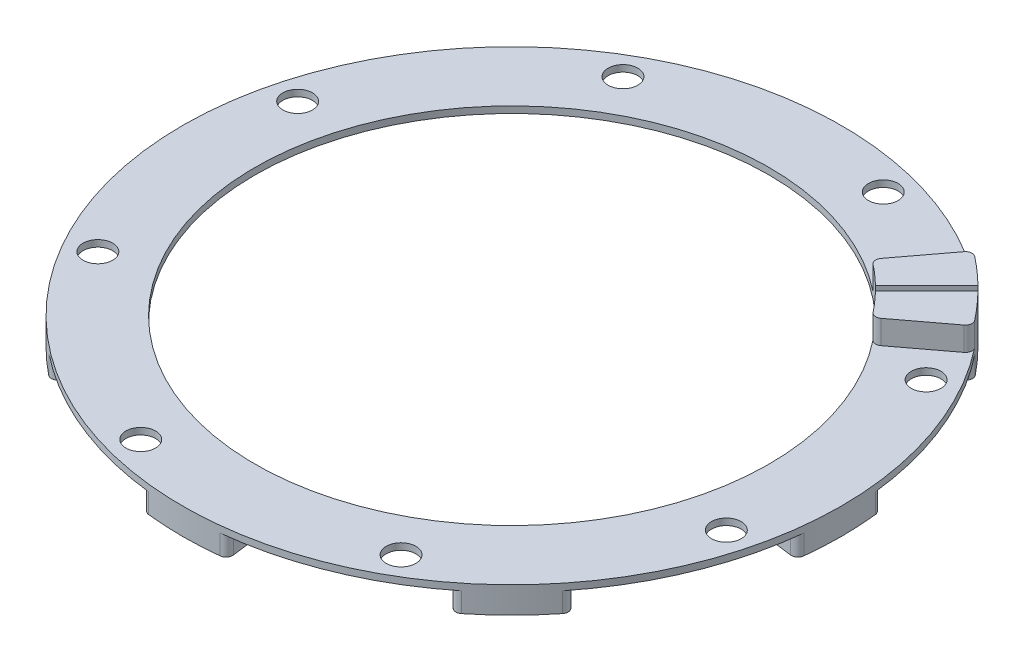
from build123d import *
from build123d.topology import SkipClean

# Parameters (mm, degrees)
SKETCH_1_R               = 50
SKETCH_1_R_2             = 39
EXTRUDE_1_DEPTH          = 1
SKETCH_2_R               = 2.25
CUT_EXTRUDE_1_DEPTH      = 2
EXTRUDE_START            = 3
EXTRUDE_2_DEPTH          = 3
FILLET_1_R               = 1
PATTERN_CIRCULAR_1_COUNT = 8
EXTRUDE_3_DEPTH          = 3.6
FILLET_2_R               = 1
FILLET_3_R               = 1
CUT_EXTRUDE_2_DEPTH      = 1


with BuildPart() as part:
    # 草图1 → 凸台-拉伸1 (new body)
    with BuildSketch(Plane(origin=(0, 0, 0), x_dir=(1, 0, 0), z_dir=(0, 1, 0))):
        with Locations(Location((0, 0, 0), (0, 0, 270))):
            Circle(SKETCH_1_R)
        with Locations(Location((0, 0, 0), (0, 0, 270))):
            Circle(SKETCH_1_R_2, mode=Mode.SUBTRACT)
    extrude(amount=EXTRUDE_1_DEPTH)

    # 草图2 → 切除-拉伸1 (cut)
    with BuildSketch(Plane(origin=(0, 1, 0), x_dir=(1, 0, 0), z_dir=(0, 1, 0))):
        with Locations(Location((11.905676075, 44.432588009, 0), (0, 0, 270))):
            Circle(SKETCH_2_R)
        with Locations(Location((-23, 39.837168574, 0), (0, 0, 270))):
            Circle(SKETCH_2_R)
        with Locations(Location((39.837168574, 23, 0), (0, 0, 270))):
            Circle(SKETCH_2_R)
        with Locations(Location((44.432588009, -11.905676075, 0), (0, 0, 270))):
            Circle(SKETCH_2_R)
        with Locations(Location((23, -39.837168574, 0), (0, 0, 270))):
            Circle(SKETCH_2_R)
        with Locations(Location((-11.905676075, -44.432588009, 0), (0, 0, 270))):
            Circle(SKETCH_2_R)
        with Locations(Location((-39.837168574, -23, 0), (0, 0, 270))):
            Circle(SKETCH_2_R)
        with Locations(Location((-44.432588009, 11.905676075, 0), (0, 0, 270))):
            Circle(SKETCH_2_R)
    extrude(amount=-CUT_EXTRUDE_1_DEPTH, mode=Mode.SUBTRACT)

    # 草图3 → 凸台-拉伸2 (add)
    with BuildSketch(Plane.XZ.offset(EXTRUDE_START)):
        with BuildLine():
            ThreePointArc((-5.873079204, 45.220205005), (-2.942673256, 45.504952193), (0, 45.6))
            Line((0, 45.6), (0, 50))
            ThreePointArc((0, 50), (-3.226615413, 49.895780914), (-6.439779829, 49.583558119))
            Line((-6.439779829, 49.583558119), (-5.873079204, 45.220205005))
        make_face()
        with BuildLine():
            Line((0, 50), (0, 45.6))
            ThreePointArc((0, 45.6), (2.942673256, 45.504952193), (5.873079204, 45.220205005))
            Line((5.873079204, 45.220205005), (6.439779829, 49.583558119))
            ThreePointArc((6.439779829, 49.583558119), (3.226615413, 49.895780914), (0, 50))
        make_face()
    extrude_2 = extrude(amount=-EXTRUDE_2_DEPTH)

    # 圆角1
    fillet_1_edges = [part.edges().sort_by_distance(p)[0] for p in [
        (-5.873079204, -1.5, 45.220205005),
        (5.873079204, -1.5, 45.220205005),
    ]]
    fillet(fillet_1_edges, radius=FILLET_1_R)

    # 阵列(圆周)1: 凸台-拉伸2 ×8 about axis
    with SkipClean():  # the faces are left unmerged after this step: merging them gives an invalid solid
        pattern_circular_1_axis = Axis((0, 0, 0), (0, 1, 0))
        for i in range(1, PATTERN_CIRCULAR_1_COUNT):
            add(extrude_2.rotate(pattern_circular_1_axis, i * 360 / PATTERN_CIRCULAR_1_COUNT))

    # 草图4 → 凸台-拉伸3 (add)
    with SkipClean():  # the faces are left unmerged after this step: merging them gives an invalid solid
        with BuildSketch(Plane(origin=(0, 1, 0), x_dir=(1, 0, 0), z_dir=(0, 1, 0))):
            with BuildLine():
                ThreePointArc((23.470785903, 31.146784892), (27.577164466, 27.577164466), (31.146784892, 23.470785903))
                Line((31.146784892, 23.470785903), (39.931775502, 30.090751158))
                ThreePointArc((39.931775502, 30.090751158), (35.355339059, 35.355339059), (30.090751158, 39.931775502))
                Line((30.090751158, 39.931775502), (23.470785903, 31.146784892))
            make_face()
        extrude(amount=EXTRUDE_3_DEPTH)

    # 圆角2
    # the kernel refuses this fillet: 1 mm, written as the material it takes off along each edge
    with BuildSketch(Plane(origin=(30.090751158, 1, -39.931775502), x_dir=(0.7924526369681321, 0, 0.6099334538802196), z_dir=(0, 1, 0))) as fillet_2_piece_1:
        with BuildLine():
            CenterArc((1.010256684, -0.999947932), FILLET_2_R, 89.415308597, 91.169382806)
            Line((0.010308753, -1.010152545), (0, 0))
            ThreePointArc((0, 0), (0.510230649, 0.002603421), (1.020461297, 0))
        make_face()
    extrude(amount=6.151153243, mode=Mode.SUBTRACT)
    with BuildSketch(Plane(origin=(23.470785903, 1, -31.146784892), x_dir=(0.791049828797745, 0, 0.6117517211737605), z_dir=(0, 1, 0))) as fillet_2_piece_2:
        with BuildLine():
            CenterArc((0.98757717, 0.99992186), FILLET_2_R, 180.716271869, 88.567456262)
            Line((-0.01234469, 0.987420883), (0, 0))
            ThreePointArc((0, 0), (0.487538096, 0.00304747), (0.975076193, 0))
        make_face()
    extrude(amount=6.068745116, mode=Mode.SUBTRACT)
    with BuildSketch(Plane(origin=(31.146784892, 1, -23.470785903), x_dir=(-0.611751721173858, 0, -0.7910498287976696), z_dir=(0, 1, 0))) as fillet_2_piece_3:
        with BuildLine():
            CenterArc((0.98757717, -0.99992186), FILLET_2_R, 90.716271869, 88.567456262)
            Line((-0.01234469, -0.987420883), (0, 0))
            ThreePointArc((0, 0), (0.487538096, -0.00304747), (0.975076193, 0))
        make_face()
    extrude(amount=6.068745116, mode=Mode.SUBTRACT)
    with BuildSketch(Plane(origin=(39.931775502, 1, -30.090751158), x_dir=(-0.6099334538803046, 0, -0.7924526369680664), z_dir=(0, 1, 0))) as fillet_2_piece_4:
        with BuildLine():
            CenterArc((1.010256684, 0.999947932), FILLET_2_R, 179.415308597, 91.169382806)
            Line((0.010308753, 1.010152545), (0, 0))
            ThreePointArc((0, 0), (0.510230649, -0.002603421), (1.020461297, 0))
        make_face()
    extrude(amount=6.151153243, mode=Mode.SUBTRACT)

    # 圆角3
    # the kernel refuses this fillet: 1 mm, written as the material it takes off along each edge
    with BuildSketch(Plane(origin=(5.873079204, -5.473172877, -45.220205005), x_dir=(-0.9929960778530438, 0, -0.11814732061486549), z_dir=(0, 1, 0)), Plane(origin=(-27.822619474, -5.473172877, -36.128407737), x_dir=(-0.7856970319273249, 0, 0.6186114887557392), z_dir=(0, 1, 0)), Plane(origin=(-45.220205005, -5.473172877, -5.873079204), x_dir=(-0.11814732061486613, 0, 0.9929960778530437), z_dir=(0, 1, 0)), Plane(origin=(-36.128407737, -5.473172877, 27.822619474), x_dir=(0.6186114887557375, 0, 0.7856970319273263), z_dir=(0, 1, 0)), Plane(origin=(27.822619474, -5.473172877, 36.128407737), x_dir=(0.7856970319273222, 0, -0.6186114887557427), z_dir=(0, 1, 0)), Plane(origin=(45.220205005, -5.473172877, 5.873079204), x_dir=(0.11814732061486592, 0, -0.9929960778530437), z_dir=(0, 1, 0)), Plane(origin=(36.128407737, -5.473172877, -27.822619474), x_dir=(-0.6186114887557427, 0, -0.7856970319273222), z_dir=(0, 1, 0))) as fillet_3_piece_1:
        with BuildLine():
            CenterArc((0.989327342, -0.999942429), FILLET_3_R, 90.614808775, 88.770382449)
            Line((-0.010615087, -0.989212198), (0, 0))
            ThreePointArc((0, 0), (0.489298555, -0.002625219), (0.978597111, 0))
        make_face()
    extrude(amount=5.473172877, mode=Mode.SUBTRACT)
    with BuildSketch(Plane(origin=(-5.873079204, -5.473172877, -45.220205005), x_dir=(-0.1287955965775636, 0, -0.9916711623830904), z_dir=(0, 1, 0)), Plane(origin=(-36.128407737, -5.473172877, -27.822619474), x_dir=(-0.7922896433551908, 0, -0.6101451639012675), z_dir=(0, 1, 0)), Plane(origin=(-45.220205005, -5.473172877, 5.873079204), x_dir=(-0.9916711623830903, 0, 0.12879559657756398), z_dir=(0, 1, 0)), Plane(origin=(-27.822619474, -5.473172877, 36.128407737), x_dir=(-0.6101451639012675, 0, 0.7922896433551908), z_dir=(0, 1, 0)), Plane(origin=(36.128407737, -5.473172877, 27.822619474), x_dir=(0.7922896433551925, 0, 0.6101451639012652), z_dir=(0, 1, 0)), Plane(origin=(45.220205005, -5.473172877, -5.873079204), x_dir=(0.9916711623830904, 0, -0.1287955965775636), z_dir=(0, 1, 0)), Plane(origin=(27.822619474, -5.473172877, -36.128407737), x_dir=(0.6101451639012653, 0, -0.7922896433551926), z_dir=(0, 1, 0))) as fillet_3_piece_2:
        with BuildLine():
            CenterArc((0.989269151, -1), FILLET_3_R, 90, 88.770382449)
            ThreePointArc((-0.010500574, -0.978540773), (-0.002625219, -0.489298555), (0, 0))
            Line((0, 0), (0.989269151, 0))
        make_face()
    extrude(amount=5.473172877, mode=Mode.SUBTRACT)
    with BuildSketch(Plane(origin=(-6.439779829, -5.551153243, -49.583558119), x_dir=(0.9929338368493981, 0, -0.1186692699882022), z_dir=(0, 1, 0)), Plane(origin=(6.439779829, -5.551153243, 49.583558119), x_dir=(-0.9929338368493983, 0, 0.1186692699882015), z_dir=(0, 1, 0)), Plane(origin=(39.614482168, -5.551153243, 30.507258195), x_dir=(-0.6181984037786714, 0, 0.7860220948329013), z_dir=(0, 1, 0)), Plane(origin=(49.583558119, -5.551153243, -6.439779829), x_dir=(0.11866926998820088, 0, 0.9929338368493983), z_dir=(0, 1, 0)), Plane(origin=(30.507258195, -5.551153243, -39.614482168), x_dir=(0.7860220948329028, 0, 0.6181984037786699), z_dir=(0, 1, 0))) as fillet_3_piece_3:
        with BuildLine():
            CenterArc((1.010256684, -0.999947932), FILLET_3_R, 89.415308597, 91.169382806)
            Line((0.010308753, -1.010152545), (0, 0))
            ThreePointArc((0, 0), (0.510230649, 0.002603421), (1.020461297, 0))
        make_face()
    extrude(amount=5.551153243, mode=Mode.SUBTRACT)
    with BuildSketch(Plane(origin=(6.439779829, -5.551153243, -49.583558119), x_dir=(-0.9929338368493981, 0, -0.1186692699882022), z_dir=(0, 1, 0)), Plane(origin=(30.507258195, -5.551153243, 39.614482168), x_dir=(0.7860220948329047, 0, -0.6181984037786672), z_dir=(0, 1, 0)), Plane(origin=(49.583558119, -5.551153243, 6.439779829), x_dir=(0.11866926998820333, 0, -0.992933836849398), z_dir=(0, 1, 0)), Plane(origin=(39.614482168, -5.551153243, -30.507258195), x_dir=(-0.6181984037786714, 0, -0.7860220948329013), z_dir=(0, 1, 0))) as fillet_3_piece_4:
        with BuildLine():
            CenterArc((1.010256684, 0.999947932), FILLET_3_R, 179.415308597, 91.169382806)
            Line((0.010308753, 1.010152545), (0, 0))
            ThreePointArc((0, 0), (0.510230649, -0.002603421), (1.020461297, 0))
        make_face()
    extrude(amount=5.551153243, mode=Mode.SUBTRACT)
    with BuildSketch(Plane(origin=(-39.614482168, -5.551153243, -30.507258195), x_dir=(0.7922896433551889, 0, 0.61014516390127), z_dir=(0, 1, 0)), Plane(origin=(-49.583558119, -5.551153243, 6.439779829), x_dir=(0.9916711623830904, 0, -0.12879559657756223), z_dir=(0, 1, 0)), Plane(origin=(-30.507258195, -5.551153243, 39.614482168), x_dir=(0.6101451639012682, 0, -0.7922896433551903), z_dir=(0, 1, 0))) as fillet_3_piece_5:
        with BuildLine():
            CenterArc((1.010205144, 1), FILLET_3_R, 178.830617194, 91.169382806)
            ThreePointArc((0.010413413, 1.020408163), (0.002603421, 0.510230649), (0, 0))
            Line((0, 0), (1.010205144, 0))
        make_face()
    extrude(amount=5.551153243, mode=Mode.SUBTRACT)
    with BuildSketch(Plane(origin=(-30.507258195, -5.551153243, -39.614482168), x_dir=(0.6101451639012663, 0, 0.7922896433551917), z_dir=(0, 1, 0)), Plane(origin=(-49.583558119, -5.551153243, -6.439779829), x_dir=(0.9916711623830905, 0, 0.1287955965775631), z_dir=(0, 1, 0)), Plane(origin=(-39.614482168, -5.551153243, 30.507258195), x_dir=(0.7922896433551917, 0, -0.6101451639012663), z_dir=(0, 1, 0)), Plane(origin=(-6.439779829, -5.551153243, 49.583558119), x_dir=(0.1287955965775631, 0, -0.9916711623830905), z_dir=(0, 1, 0))) as fillet_3_piece_6:
        with BuildLine():
            CenterArc((1.010205144, -1), FILLET_3_R, 90, 91.169382806)
            ThreePointArc((0.010413413, -1.020408163), (0.002603421, -0.510230649), (0, 0))
            Line((0, 0), (1.010205144, 0))
        make_face()
    extrude(amount=5.551153243, mode=Mode.SUBTRACT)

    # 草图5 → 切除-拉伸2 (cut)
    with BuildSketch(Plane(origin=(0, 4.6, 0), x_dir=(1, 0, 0), z_dir=(0, 1, 0))):
        Polygon((36.054313611, 36.761420392), (36.761420392, 36.054313611), (25.110197925, 24.403091144), (24.403091144, 25.110197925), align=None)
    extrude(amount=-CUT_EXTRUDE_2_DEPTH, mode=Mode.SUBTRACT)


solid = part.part
